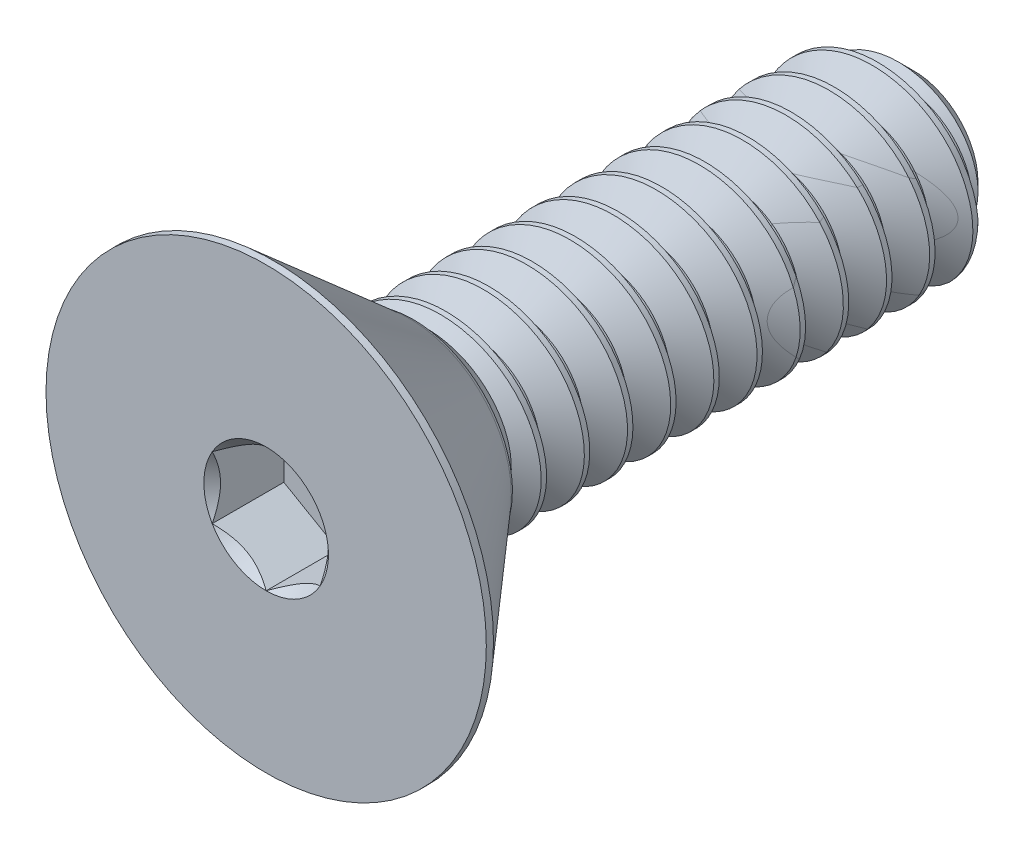
from build123d import *

# Parameters (mm, degrees)
FILLET1_R              = 0.28448
CHAMFER1_SIZE          = 0.47625
CUT_EXTRUDE1_DEPTH     = 1.0541
CUT_SWEEP1_PITCH       = 0.635
CUT_SWEEP1_TO          = 7.4168
SPLIT2_SURFACE_1_BACK  = 14.215
SPLIT2_SURFACE_1_DEPTH = 28.43
SPLIT2_SURFACE_2_BACK  = 14.215
SPLIT2_SURFACE_2_DEPTH = 28.43


with BuildPart() as part:
    # Sketch3 → Revolve1 (revolve)
    with BuildSketch(Plane(origin=(0, 0, 0), x_dir=(0, 0, -1), z_dir=(1, 0, 0)), mode=Mode.PRIVATE) as revolve1_sk:
        Polygon((-4.7625, 0), (-4.7625, 3.2385), (-4.65709, 3.2385), (-2.567905936, 1.4224), (4.7625, 1.4224), (4.7625, 0), align=None)
    revolve(revolve1_sk.sketch.rotate(Axis((0, 0, 4.7625), (0, 0, -1)), 90), axis=Axis((0, 0, 4.7625), (0, 0, -1)))

    # Fillet1
    fillet1_edges = [part.edges().sort_by_distance(p)[0] for p in [
        (-1.4224, 0, 2.567905936),
    ]]
    fillet(fillet1_edges, radius=FILLET1_R)

    # Chamfer1
    chamfer1_edges = [part.edges().sort_by_distance(p)[0] for p in [
        (-1.4224, 0, -4.7625),
    ]]
    chamfer(chamfer1_edges, length=CHAMFER1_SIZE)

    # Sketch4 → Cut-Extrude1 (cut)
    with BuildSketch(Plane.XY.offset(4.7625)):
        Polygon((0.79375, 0.458271776), (0, 0.916543552), (-0.79375, 0.458271776), (-0.79375, -0.458271776), (0, -0.916543552), (0.79375, -0.458271776), align=None)
    extrude(amount=-CUT_EXTRUDE1_DEPTH, mode=Mode.SUBTRACT)

    # Cut-Extrude3 cone 1 section (through the dimple's axis) → Cut-Extrude3 (revolve, cut)
    with BuildSketch(Plane(origin=(0, 0, 4.7625), x_dir=(0, -1, 0), z_dir=(1, 0, 0))):
        Polygon((0, 0), (0.916543552, 0), (0, 0.916543552), align=None)
    revolve(axis=Axis((0, 0, 4.7625), (0, 0, -1)), mode=Mode.SUBTRACT)


with BuildPart() as body_2:
    # Split1: the piece on the far side of the plane
    add(part.part)
    split(bisect_by=Plane.XY.offset(2.6543), keep=Keep.BOTTOM)

    # Cut-Sweep1: arcs per turn and ends read off the stored shape
    # Cut-Sweep1: the profile of Sketch8 screwed along a right-hand helix through 16 turns, 6 arcs to a turn; built about Z, then put on its axis
    cut_sweep1_z = Axis((0, 0, 0), (0, 0, 1))
    cut_sweep1_corners = [(1.009955401, 0, -0.238125), (1.009955401, 0, -0.3175), (1.456770383, 0, -0.57546875), (1.456770383, 0, 0.01984375)]
    with BuildLine(mode=Mode.PRIVATE) as cut_sweep1_profile:
        Line(cut_sweep1_corners[0], cut_sweep1_corners[1])
        Line(cut_sweep1_corners[1], cut_sweep1_corners[2])
        Line(cut_sweep1_corners[2], cut_sweep1_corners[3])
        Line(cut_sweep1_corners[3], cut_sweep1_corners[0])
    cut_sweep1_cap = Face(cut_sweep1_profile.wire())
    cut_sweep1_turn_angles = [0, 30, 60, 90, 120, 150, 180, 210, 240, 270, 300, 330, 360]
    cut_sweep1_turn_weights = [1, 0.8660254037844387, 1, 0.8660254037844387, 1, 0.8660254037844387, 1, 0.8660254037844387, 1, 0.8660254037844387, 1, 0.8660254037844387, 1]
    cut_sweep1_turn_rails = [Edge.make_bspline([Vector(p[0], p[1], 0).rotate(cut_sweep1_z, cut_sweep1_turn_angles[k]) / cut_sweep1_turn_weights[k] + Vector(0, 0, p[2] + CUT_SWEEP1_PITCH * cut_sweep1_turn_angles[k] / 360) for k in range(13)], [0, 0, 0, 1, 1, 2, 2, 3, 3, 4, 4, 5, 5, 6, 6, 6], 2, cut_sweep1_turn_weights) for p in cut_sweep1_corners]
    cut_sweep1_turn_sides = [Face.make_surface_from_curves(cut_sweep1_turn_rails[p[0]], cut_sweep1_turn_rails[p[1]]) for p in [(0, 1), (1, 2), (2, 3), (3, 0)]]
    cut_sweep1 = Plane(origin=(0, 0, -4.7625), x_dir=(0, 1, 0), z_dir=(0, 0, 1)) * split(Solid(Shell([*[p.moved(Location((0, 0, CUT_SWEEP1_PITCH * i))) for i in range(16) for p in cut_sweep1_turn_sides], cut_sweep1_cap, cut_sweep1_cap.rotate(cut_sweep1_z, 5760).moved(Location((0, 0, CUT_SWEEP1_PITCH * 5760 / 360)))])), bisect_by=Plane.XY.offset(CUT_SWEEP1_TO), keep=Keep.BOTTOM, mode=Mode.PRIVATE)
    add(cut_sweep1, mode=Mode.SUBTRACT)


with BuildPart() as part_1:
    add(part.part)

    # Split1
    split(bisect_by=Plane.XY.offset(2.6543), keep=Keep.TOP)

    add(body_2.part)  # Boss-Extrude1 merges body 2
    # Boss-Extrude1 cone 1 section (through the dimple's axis) → Boss-Extrude1 (revolve)
    with BuildSketch(Plane(origin=(0, 0, 2.6543), x_dir=(0, -1, 0), z_dir=(1, 0, 0))):
        Polygon((0, 0), (1.497501214, 0), (0, 1.497501214), align=None)
    revolve(axis=Axis((0, 0, 2.6543), (0, 0, -1)))


with BuildPart() as body_2_2:
    # Split2: the piece behind the surface
    add(part_1.part)
    # Split2 surface: a surface, the sketch's curves swept straight by 28.43 mm
    with BuildLine(Plane(origin=(0, 0, 0), x_dir=(0, 0, -1), z_dir=(1, 0, 0)).offset(-SPLIT2_SURFACE_1_BACK), mode=Mode.PRIVATE) as split2_surface_1_path:
        EllipticalCenterArc((2.809799511, 0), 1.317700489, 0.941214635, start_angle=0, arc_size=360)
    split2_surface_1 = Shell.extrude(split2_surface_1_path.wire(), (1 * SPLIT2_SURFACE_1_DEPTH, 0 * SPLIT2_SURFACE_1_DEPTH, 0 * SPLIT2_SURFACE_1_DEPTH))
    split(bisect_by=split2_surface_1, keep=Keep.BOTTOM)


with BuildPart() as part_2:
    add(part_1.part)

    # Split2: split by a surface, the side it looks to stays
    # Split2 surface: a surface, the sketch's curves swept straight by 28.43 mm
    with BuildLine(Plane(origin=(0, 0, 0), x_dir=(0, 0, -1), z_dir=(1, 0, 0)).offset(-SPLIT2_SURFACE_2_BACK), mode=Mode.PRIVATE) as split2_surface_2_path:
        EllipticalCenterArc((2.809799511, 0), 1.317700489, 0.941214635, start_angle=0, arc_size=360)
    split2_surface_2 = Shell.extrude(split2_surface_2_path.wire(), (1 * SPLIT2_SURFACE_2_DEPTH, 0 * SPLIT2_SURFACE_2_DEPTH, 0 * SPLIT2_SURFACE_2_DEPTH))
    split(bisect_by=split2_surface_2, keep=Keep.TOP)


solid = Compound([body_2_2.part, part_2.part])
